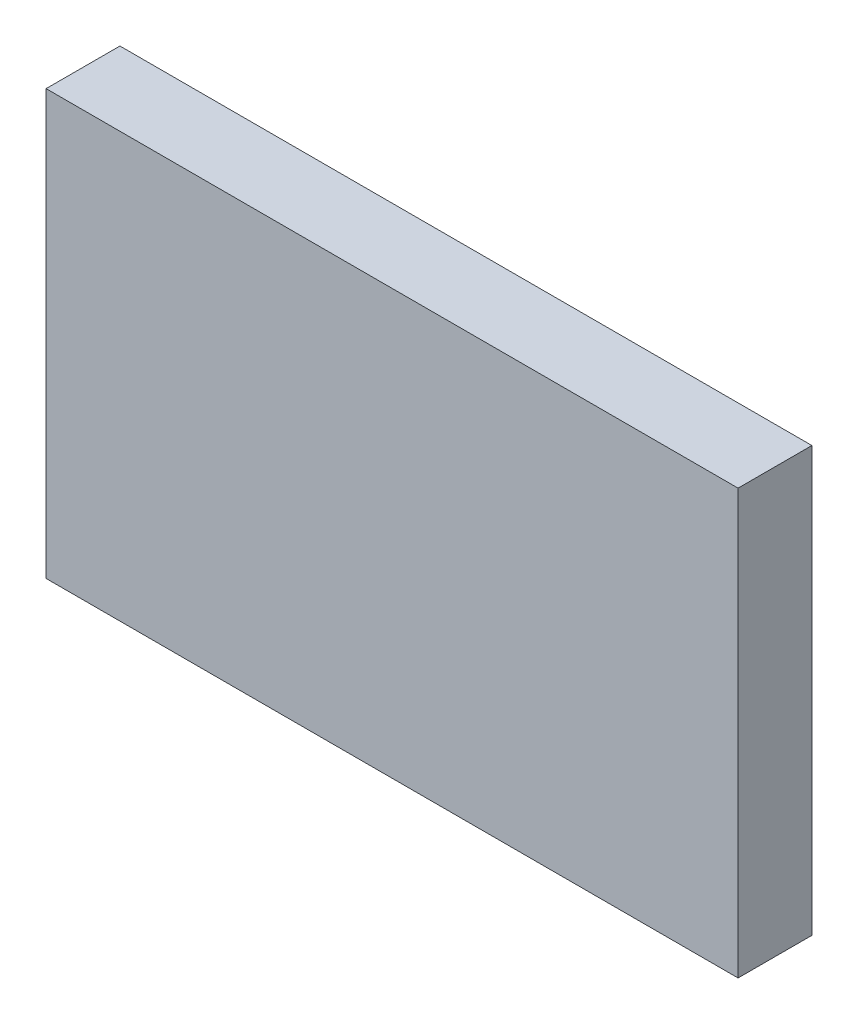
from build123d import *

# Parameters (mm, degrees)
SKETCH1_W           = 178.097916108
SKETCH1_H           = 109.190987083
BOSS_EXTRUDE1_DEPTH = 19


with BuildPart() as part:
    # Sketch1 → Boss-Extrude1 (new body)
    with BuildSketch(Plane.XY):
        with Locations((89.048958054, 54.595493542)):
            Rectangle(SKETCH1_W, SKETCH1_H)
    extrude(amount=BOSS_EXTRUDE1_DEPTH)


solid = part.part
